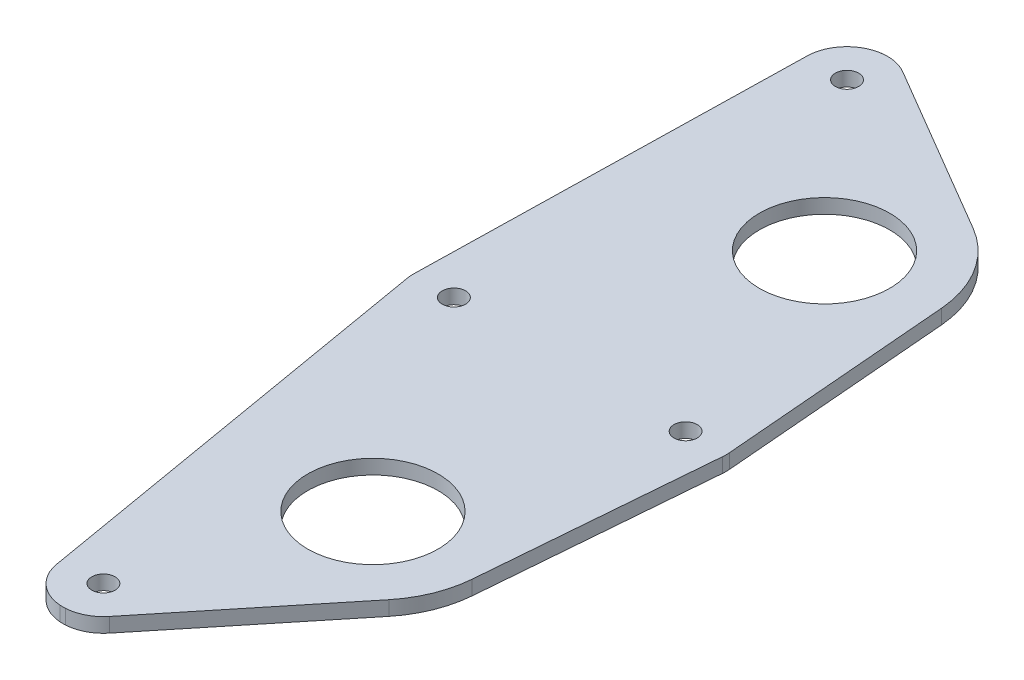
from build123d import *

# Parameters (mm, degrees)
SKETCH1_W                  = 88.9
SKETCH1_H                  = 203.2
SKETCH1_R                  = 14.2875
BOSS_EXTRUDE1_DEPTH        = 3.175
F_10_CLEARANCE_HOLE1_D     = 5.1054
F_10_CLEARANCE_HOLE1_DEPTH = 3.175
F_10_CLEARANCE_HOLE1_TIP   = 1.533816902
SKETCH4_OUTSIDE_W          = 135.264
SKETCH4_OUTSIDE_H          = 249.564
CUT_EXTRUDE1_DEPTH         = 114.636616568


with BuildPart() as part:
    # Sketch1 → Boss-Extrude1 (new body)
    with BuildSketch(Plane(origin=(0, 0, 0), x_dir=(1, 0, 0), z_dir=(0, 1, 0))):
        with Locations((-6.35, 0)):
            Rectangle(SKETCH1_W, SKETCH1_H)
        with Locations((0, 49.5046)):
            Circle(SKETCH1_R, mode=Mode.SUBTRACT)
        with Locations((0, -49.5046)):
            Circle(SKETCH1_R, mode=Mode.SUBTRACT)
    extrude(amount=BOSS_EXTRUDE1_DEPTH)

    # #10 Clearance Hole1
    with Locations(Plane(origin=(0, 3.175, 0), x_dir=(1, 0, 0), z_dir=(0, 1, 0))):
        with Locations((19.05, 0), (-29.994929259, 84.4296), (-15.875, -92.718437844), (-31.75, 0)):
            Hole(F_10_CLEARANCE_HOLE1_D / 2, depth=F_10_CLEARANCE_HOLE1_DEPTH)
            with Locations((0, 0, -(F_10_CLEARANCE_HOLE1_DEPTH + F_10_CLEARANCE_HOLE1_TIP / 2))):  # 118° drill point
                Cone(0, F_10_CLEARANCE_HOLE1_D / 2, F_10_CLEARANCE_HOLE1_TIP, mode=Mode.SUBTRACT)

    # Sketch4 outside → Cut-Extrude1 (cut, through all)
    with BuildSketch(Plane(origin=(0, 3.175, 0), x_dir=(1, 0, 0), z_dir=(0, 1, 0))):
        with Locations((-6.35, 0)):
            Rectangle(SKETCH4_OUTSIDE_W, SKETCH4_OUTSIDE_H)
        with BuildLine():
            Line((12.066451595, 70.033504066), (-25.483685223, 92.104672933))
            ThreePointArc((-25.483685223, 92.104672933), (-34.335690579, 92.202363888), (-38.895706385, 84.614623896))
            Line((-38.895706385, 84.614623896), (-40.650777126, 0.185023896))
            ThreePointArc((-40.650777126, 0.185023896), (-40.628075302, -0.661699498), (-40.525007812, -1.502433089))
            Line((-40.525007812, -1.502433089), (-24.650007812, -94.220870934))
            ThreePointArc((-24.650007812, -94.220870934), (-18.130531153, -101.330676027), (-8.962948985, -98.329286092))
            Line((-8.962948985, -98.329286092), (18.488010918, -64.51221835))
            ThreePointArc((18.488010918, -64.51221835), (22.094858997, -58.384485254), (23.731666658, -51.464996354))
            Line((23.731666658, -51.464996354), (27.922479108, -0.73292685))
            ThreePointArc((27.922479108, -0.73292685), (27.9527, 0), (27.922479108, 0.73292685))
            Line((27.922479108, 0.73292685), (23.731666658, 51.464996354))
            ThreePointArc((23.731666658, 51.464996354), (20.163672465, 62.171938669), (12.066451595, 70.033504066))
        make_face(mode=Mode.SUBTRACT)
    extrude(amount=-CUT_EXTRUDE1_DEPTH, mode=Mode.SUBTRACT)


solid = part.part
